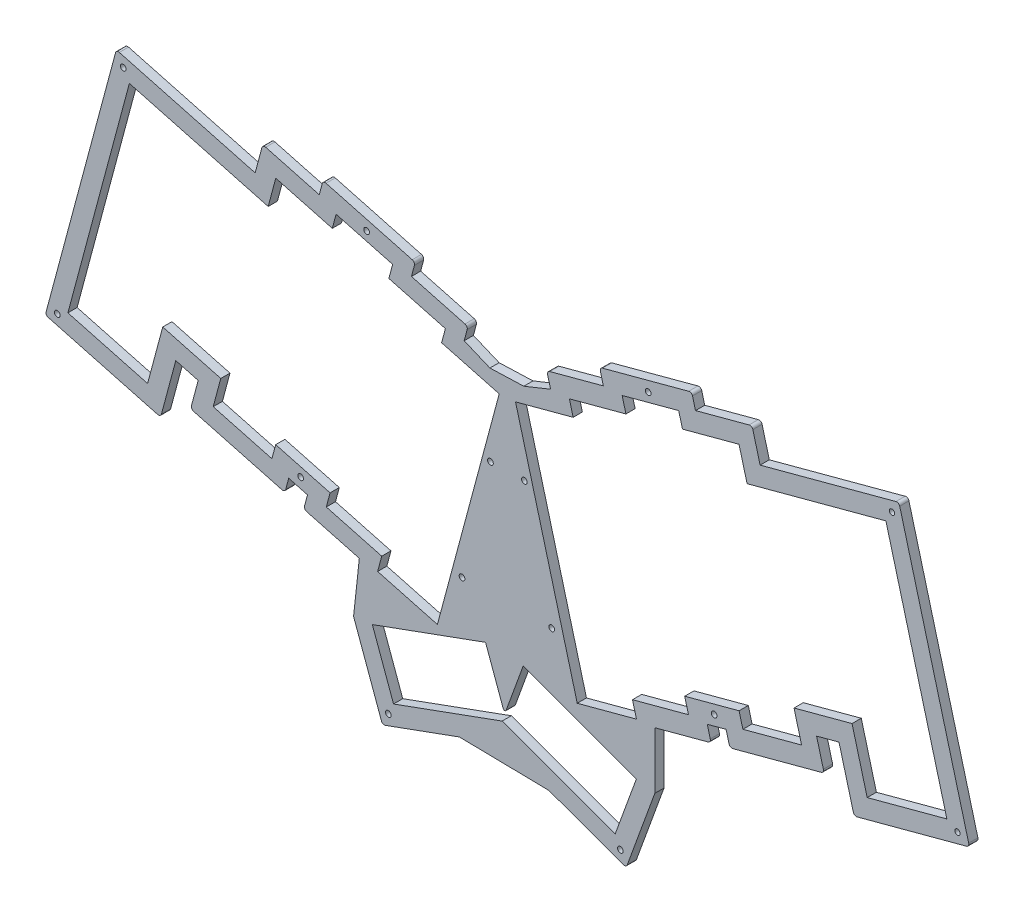
from build123d import *

# Parameters (mm, degrees)
MODEL_R             = 0.925
MODEL_R_2           = 0.875
BOSS_EXTRUDE1_DEPTH = 3
FILLET2_R           = 0.5
FILLET3_R           = 1


with BuildPart() as part:
    # Model → Boss-Extrude1 (new body)
    with BuildSketch(Plane.XY):
        Polygon((142.344747242, 270.871489374), (153.37187249, 271.263447748), (162.091473536, 274.767362889), (160.85900272, 279.367807803), (179.260689602, 284.297666211), (178.028627015, 288.898354165), (208.019481767, 296.93522173), (209.252454514, 292.334187025), (227.65276755, 297.263677376), (230.276304619, 287.470798216), (275.446186014, 299.571346393), (298.39980436, 213.909597233), (260.87259576, 203.855963236), (255.943287021, 222.255598366), (248.650938057, 220.301667543), (251.115775513, 211.101166572), (220.422247557, 202.878292884), (219.189771603, 207.477473721), (213.081966369, 205.841177268), (214.314693354, 201.241059665), (196.039346948, 196.343682115), (196.007810089, 177.840578221), (186.702312667, 152.27893851), (161.565977706, 161.426447529), (132.435827139, 161.934428279), (107.399642776, 152.824765622), (97.980730454, 178.710864183), (99.858189105, 195.997881416), (81.758593313, 200.846808858), (82.991121062, 205.447466285), (76.882860045, 207.083884844), (75.650856625, 202.485184579), (44.956891994, 210.708175253), (47.421773629, 219.90863481), (40.129543563, 221.862285479), (35.199939127, 203.463086712), (-2.32684459, 213.517448416), (20.785545351, 299.774827661), (65.955825932, 287.671594898), (68.42160019, 296.872525865), (86.820985153, 291.940533454), (88.054439652, 296.542595671), (118.044472643, 288.503706576), (116.812112756, 283.905728394), (135.211333861, 278.973779905), (133.979081507, 274.376202933), align=None)
        with Locations((23.035554, 295.877718337)):
            Circle(MODEL_R, mode=Mode.SUBTRACT)
        with Locations((109.301822433, 156.902965293)):
            Circle(MODEL_R, mode=Mode.SUBTRACT)
        with Locations((184.800560745, 156.35733766)):
            Circle(MODEL_R, mode=Mode.SUBTRACT)
        with Locations((193.847437398, 289.84318413)):
            Circle(MODEL_R, mode=Mode.SUBTRACT)
        with Locations((102.225689846, 289.449650012)):
            Circle(MODEL_R, mode=Mode.SUBTRACT)
        with Locations((273.19609114, 295.674286852)):
            Circle(MODEL_R_2, mode=Mode.SUBTRACT)
        with Locations((1.570241786, 215.767496811)):
            Circle(MODEL_R, mode=Mode.SUBTRACT)
        with Locations((294.502731407, 216.159668876)):
            Circle(MODEL_R_2, mode=Mode.SUBTRACT)
        with Locations((80.760413887, 209.339268578)):
            Circle(MODEL_R, mode=Mode.SUBTRACT)
        with Locations((215.312231294, 209.732861073)):
            Circle(MODEL_R, mode=Mode.SUBTRACT)
        with Locations((133.281102646, 207.339464548)):
            Circle(MODEL_R, mode=Mode.SUBTRACT)
        with Locations((162.46850521, 207.598897954)):
            Circle(MODEL_R, mode=Mode.SUBTRACT)
        with Locations((142.522359716, 244.531276159)):
            Circle(MODEL_R, mode=Mode.SUBTRACT)
        with Locations((153.549484965, 244.723703681)):
            Circle(MODEL_R, mode=Mode.SUBTRACT)
        Polygon((271.203498451, 292.223209107), (291.05122826, 218.15247975), (265.115556398, 211.204247731), (260.186189629, 229.604099473), (241.30271159, 224.544411578), (243.767491017, 215.34412721), (224.664804007, 210.226469096), (223.432328054, 214.825649934), (205.733277658, 210.084029615), (206.966112962, 205.483507804), (188.744476932, 200.600523414), (190.038361872, 195.770837942), (170.765567452, 190.607607624), (150.690394167, 265.500431998), (169.439649748, 270.524806438), (168.207287216, 275.124847165), (186.60841776, 280.054556529), (185.376246939, 284.655648642), (203.777033628, 289.586641337), (205.009898064, 284.986010813), (223.409806911, 289.915392881), (226.033325469, 280.122582817), align=None, mode=Mode.SUBTRACT)
        Polygon((91.063082461, 284.591613875), (72.663861356, 289.523562363), (70.198239559, 280.323200295), (25.028202346, 292.426367848), (5.0216469, 217.76022363), (30.957132238, 210.811459981), (35.886712889, 229.210569975), (54.770081908, 224.151554257), (52.305208977, 214.951127188), (71.407895987, 209.833469074), (72.639899407, 214.432169339), (90.339405557, 209.690426923), (89.106877808, 205.089769496), (107.149713912, 200.256048118), (105.814746135, 195.273012707), (125.26498777, 190.062243831), (145.381260936, 265.108396206), (126.630323598, 270.134062294), (127.862619282, 274.731800932), (109.463398178, 279.663749421), (110.695758065, 284.261727603), (92.29653696, 289.193676092), align=None, mode=Mode.SUBTRACT)
        Polygon((104.096364698, 179.45072575), (110.986427135, 160.514692668), (131.428930231, 167.95289908), (146.304188304, 173.365408471), (162.674398087, 167.40803076), (183.116533861, 159.968814913), (190.009613349, 178.903688177), (153.172596304, 192.31106529), (147.151959777, 175.767027333), (140.930891121, 192.858221652), align=None, mode=Mode.SUBTRACT)
    extrude(amount=-BOSS_EXTRUDE1_DEPTH)

    # Fillet2
    fillet2_edges = [part.edges().sort_by_distance(p)[0] for p in [
        (147.151959777, 175.767027333, -1.5),
    ]]
    fillet(fillet2_edges, radius=FILLET2_R)

    # Fillet3
    fillet3_edges = [part.edges().sort_by_distance(p)[0] for p in [
        (20.785545351, 299.774827661, -1.5),
        (68.42160019, 296.872525865, -1.5),
        (88.054439652, 296.542595671, -1.5),
        (135.211333861, 278.973779905, -1.5),
        (160.85900272, 279.367807803, -1.5),
        (178.028627015, 288.898354165, -1.5),
        (208.019481767, 296.93522173, -1.5),
        (227.65276755, 297.263677376, -1.5),
        (275.446186014, 299.571346393, -1.5),
        (298.39980436, 213.909597233, -1.5),
        (260.87259576, 203.855963236, -1.5),
        (251.115775513, 211.101166572, -1.5),
        (220.422247557, 202.878292884, -1.5),
        (214.314693354, 201.241059665, -1.5),
        (186.702312667, 152.27893851, -1.5),
        (107.399642776, 152.824765622, -1.5),
        (81.758593313, 200.846808858, -1.5),
        (75.650856625, 202.485184579, -1.5),
        (44.956891994, 210.708175253, -1.5),
        (35.199939127, 203.463086712, -1.5),
        (-2.32684459, 213.517448416, -1.5),
        (118.044472643, 288.503706576, -1.5),
    ]]
    fillet(fillet3_edges, radius=FILLET3_R)


solid = part.part
